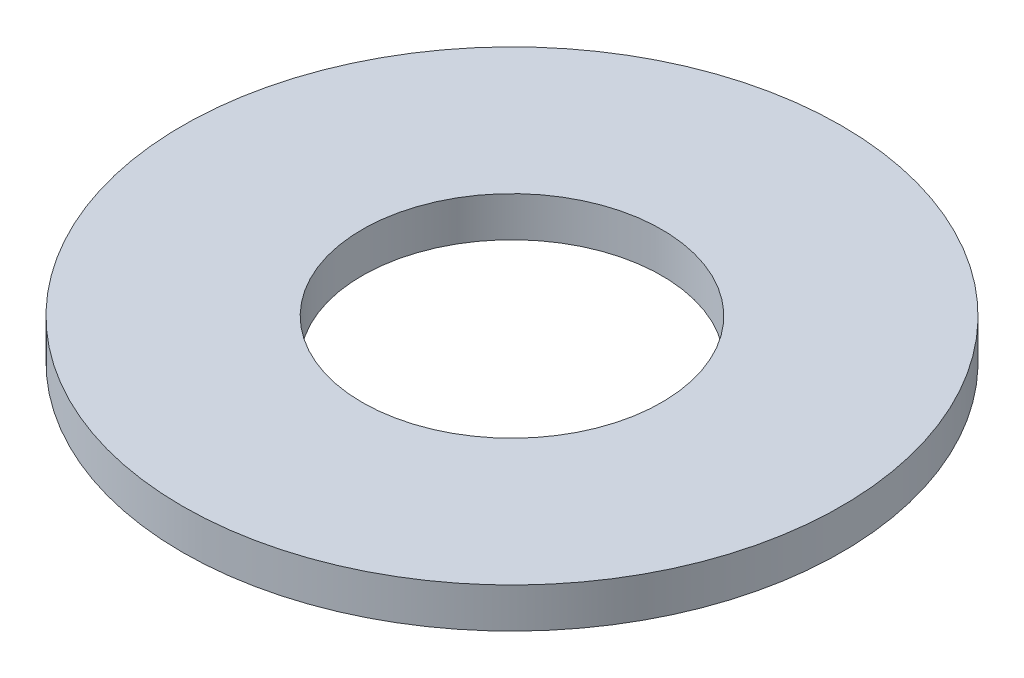
from build123d import *

# Parameters (mm, degrees)
SKETCH1_R           = 82.5
BOSS_EXTRUDE1_DEPTH = 10
SKETCH2_R           = 37.5
CUT_EXTRUDE1_DEPTH  = 118.100384286


with BuildPart() as part:
    # Sketch1 → Boss-Extrude1 (new body)
    with BuildSketch(Plane(origin=(0, 0, 0), x_dir=(1, 0, 0), z_dir=(0, 1, 0))):
        Circle(SKETCH1_R)
    extrude(amount=BOSS_EXTRUDE1_DEPTH)

    # Sketch2 → Cut-Extrude1 (cut, through all)
    with BuildSketch(Plane(origin=(0, 0, 0), x_dir=(1, 0, 0), z_dir=(0, 1, 0))):
        Circle(SKETCH2_R)
    extrude(amount=CUT_EXTRUDE1_DEPTH, mode=Mode.SUBTRACT)


solid = part.part
